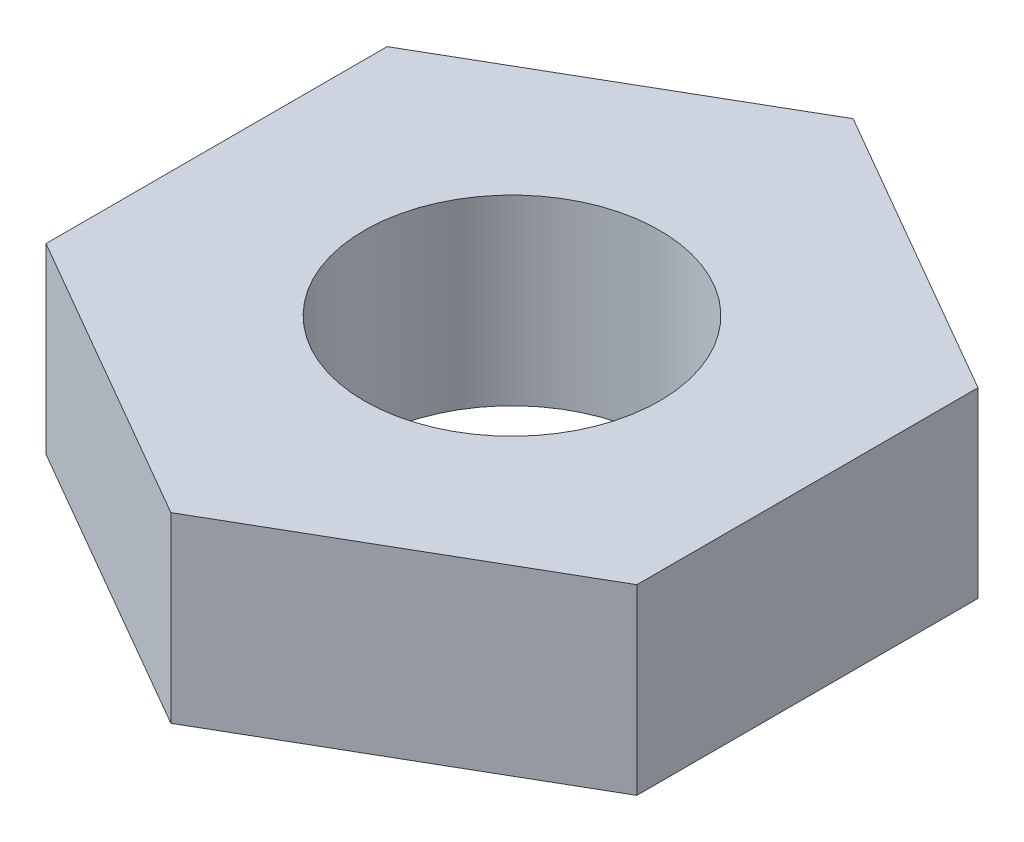
from build123d import *

# Parameters (mm, degrees)
SKETCH1_R           = 1.7272
BOSS_EXTRUDE1_DEPTH = 2.1336


with BuildPart() as part:
    # Sketch1 → Boss-Extrude1 (new body)
    with BuildSketch(Plane(origin=(0, 0, 0), x_dir=(1, 0, 0), z_dir=(0, 1, 0))):
        Polygon((3.4544, 1.99439877), (3.4544, -1.99439877), (0, -3.98879754), (-3.4544, -1.99439877), (-3.4544, 1.99439877), (0, 3.98879754), align=None)
        Circle(SKETCH1_R, mode=Mode.SUBTRACT)
    extrude(amount=BOSS_EXTRUDE1_DEPTH)


solid = part.part
